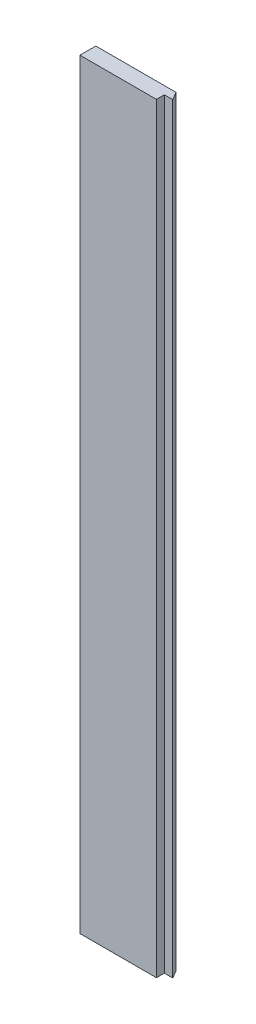
from build123d import *

# Parameters (mm, degrees)
SHAPE_DEPTH        = 1000
CUT_EXTRUDE8_REACH = 1003.96


with BuildPart() as part:
    # Sketch1 → Shape (new body)
    with BuildSketch(Plane(origin=(0, 0, 0), x_dir=(1, 0, 0), z_dir=(0, 1, 0))):
        Polygon((-41.5, 0), (-60, 0), (-60, -9), (50.5, -9), (50.5, 0), (60, 0), (54.803847577, 9), (-36.303847577, 9), align=None)
    extrude(amount=SHAPE_DEPTH)

    # Sketch10 → Cut-Extrude8 (cut, up to next)
    with BuildSketch(Plane(origin=(0, 0, -9), x_dir=(-1, 0, 0), z_dir=(0, 0, -1)), mode=Mode.PRIVATE) as cut_extrude8_sk1:
        Polygon((60, 1000), (-60, 1000), (-60, 863.148307071), (36.303847577, 863.148307071), (36.303847577, 0), (60, 0), align=None)
    cut_extrude8_tool1 = extrude(cut_extrude8_sk1.sketch, amount=-CUT_EXTRUDE8_REACH, mode=Mode.PRIVATE) & part.part
    add(cut_extrude8_tool1.solids().sort_by_distance((0, 989.928257, -9))[0], mode=Mode.SUBTRACT)


solid = part.part
